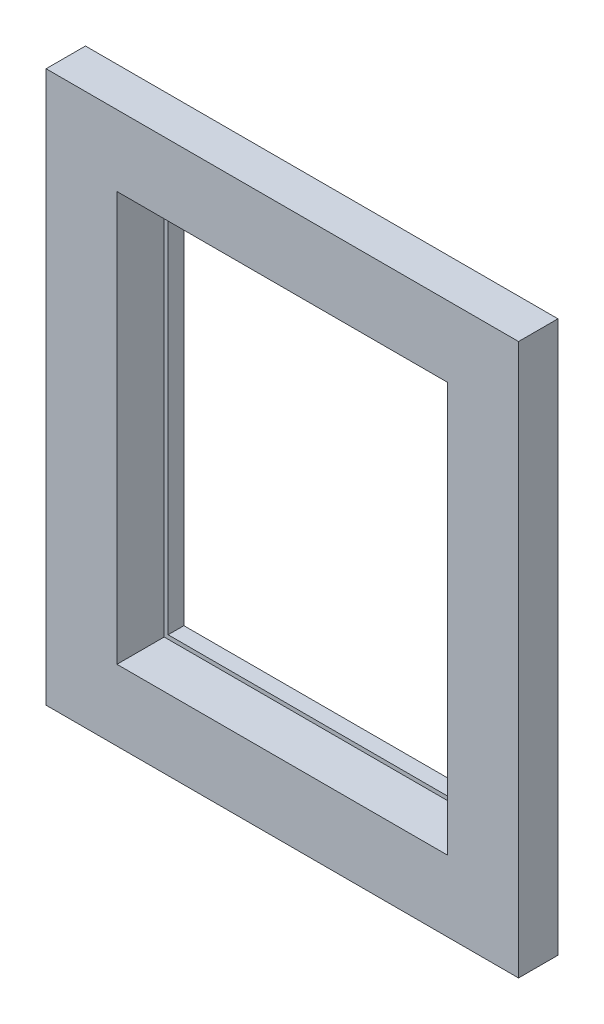
from build123d import *

# Parameters (mm, degrees)
EXTRUDE_1_DEPTH      = 6
EXTRUDE_1_DEPTH_BACK = 2
SKETCH_1_W           = 60
SKETCH_1_H           = 70
SKETCH_1_W_2         = 41
SKETCH_1_H_2         = 51
SKETCH_2_W           = 42
SKETCH_2_H           = 52
CUT_EXTRUDE_2_DEPTH  = 47.486557197
SKETCH_3_W           = 4
SKETCH_3_H           = 3
CHAMFER_2_SIZE       = 3


with BuildPart() as part:
    # Эскиз1 → Бобышка-Вытянуть1 (new, two sides: drawn at the far end of the back side and taken through both)
    with BuildSketch(Plane.XY.offset(-EXTRUDE_1_DEPTH_BACK)):
        Rectangle(SKETCH_1_W, SKETCH_1_H)
        Rectangle(SKETCH_1_W_2, SKETCH_1_H_2, mode=Mode.SUBTRACT)
    extrude(amount=EXTRUDE_1_DEPTH + EXTRUDE_1_DEPTH_BACK)

    # Эскиз2 → Вырез-Вытянуть2 (cut, through all)
    with BuildSketch(Plane(origin=(0, 0, 0), x_dir=(-1, 0, 0), z_dir=(0, 0, -1))):
        Rectangle(SKETCH_2_W, SKETCH_2_H)
    extrude(amount=-CUT_EXTRUDE_2_DEPTH, mode=Mode.SUBTRACT)

    # Вырез-По траектории1: sweep along a path in Эскиз4
    with BuildLine(Plane(origin=(0, 0, -2), x_dir=(-1, 0, 0), z_dir=(0, 0, -1))) as sweep_1_path:
        Line((-30, 35), (-30, -35))
        Line((-30, -35), (30, -35))
        Line((30, -35), (30, 35))
        Line((30, 35), (-30, 35))
    # Эскиз3 → Вырез-По траектории1 (sweep, cut)
    with BuildSketch(Plane(origin=(0, -35, 0), x_dir=(-1, 0, 0), z_dir=(0, -1, 0))):
        with Locations((-28, 0.5)):
            Rectangle(SKETCH_3_W, SKETCH_3_H)
    sweep(path=sweep_1_path.line, transition=Transition.RIGHT, mode=Mode.SUBTRACT)

    # Фаска2
    chamfer_2_edges = [part.edges().sort_by_distance(p)[0] for p in [
        (26, 0, -2),
        (0, 31, -2),
        (-26, 0, -2),
        (0, -31, -2),
    ]]
    chamfer(chamfer_2_edges, length=CHAMFER_2_SIZE - 0.0001)  # a hair under: the kernel refuses the full size


solid = part.part
